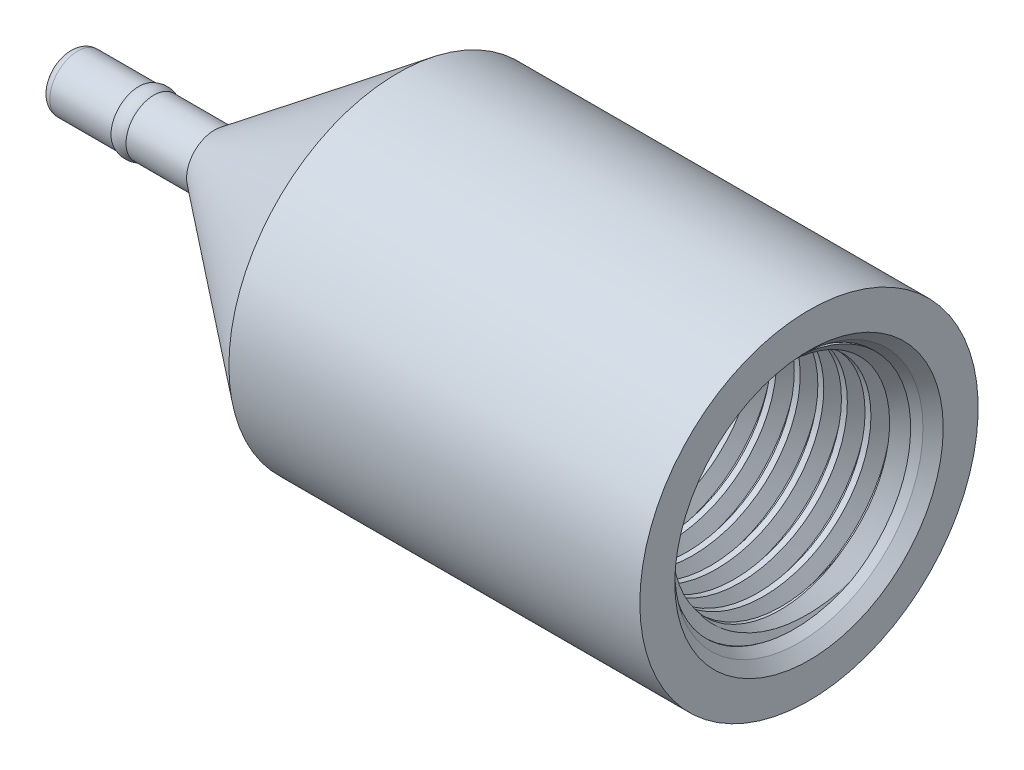
from build123d import *

# Parameters (mm, degrees)
FILLET1_R          = 0.5
THREAD1_PITCH      = 1.27
SKETCH8_R          = 7.225881332
CUT_EXTRUDE1_DEPTH = 2
CUT_EXTRUDE1_DRAFT = -45


with BuildPart() as part:
    # Sketch1 → Revolve1 (revolve)
    with BuildSketch(Plane(origin=(0, 0, 0), x_dir=(1, 0, 0), z_dir=(0, 1, 0))):
        with BuildLine():
            Line((-2.607817174, -13.413523635), (-8.728376935, -13.413523635))
            Line((-8.728376935, -13.413523635), (-11.220003046, -13.413523635))
            Line((-11.220003046, -13.413523635), (-11.220003046, -14.395862586))
            Line((-11.220003046, -14.395862586), (-9.512159646, -14.395862586))
            Line((-9.512159646, -14.395862586), (-7.427574488, -14.395862586))
            ThreePointArc((-7.427574488, -14.395862586), (-7.022483994, -14.495862586), (-6.617393501, -14.395862586))
            Line((-6.617393501, -14.395862586), (-3.358574017, -14.395862586))
            Line((-3.358574017, -14.395862586), (6.526693928, -22.003724809))
            Line((6.526693928, -22.003724809), (28.648530665, -22.003724809))
            Line((28.648530665, -22.003724809), (28.648530665, -19.949280621))
            Line((28.648530665, -19.949280621), (27.619568564, -19.245862586))
            Line((27.619568564, -19.245862586), (7.619568564, -19.245862586))
            Line((7.619568564, -19.245862586), (6.526693928, -18.623851673))
            Line((6.526693928, -18.623851673), (-2.607817174, -13.413523635))
        make_face()
    revolve(axis=Axis((-15.798654761, 0, 12.895862586), (1, 0, 0)))

    # Fillet1
    fillet1_edges = [part.edges().sort_by_distance(p)[0] for p in [
        (-11.220003046, 0, 11.395862586),
    ]]
    fillet(fillet1_edges, radius=FILLET1_R)

    # Thread1: the profile of Thread Profile6 profile screwed along a right-hand helix of 15.748031 turns, 8 arcs to a turn; built about Z, then put on its axis
    thread1_z = Axis((0, 0, 0), (0, 0, 1))
    thread1_corners = [(6.3503, 0, -0.000173205), (6.3503, 0, 1.111423202), (5.662592339, 0, 0.714374999), (5.662592339, 0, 0.396874999)]
    with BuildLine(mode=Mode.PRIVATE) as thread1_profile:
        Line(thread1_corners[0], thread1_corners[1])
        Line(thread1_corners[1], thread1_corners[2])
        Line(thread1_corners[2], thread1_corners[3])
        Line(thread1_corners[3], thread1_corners[0])
    thread1_cap = Face(thread1_profile.wire())
    thread1_turn_angles = [0, 22.5, 45, 67.5, 90, 112.5, 135, 157.5, 180, 202.5, 225, 247.5, 270, 292.5, 315, 337.5, 360]
    thread1_turn_weights = [1, 0.9238795325112867, 1, 0.9238795325112867, 1, 0.9238795325112867, 1, 0.9238795325112867, 1, 0.9238795325112867, 1, 0.9238795325112867, 1, 0.9238795325112867, 1, 0.9238795325112867, 1]
    thread1_turn_rails = [Edge.make_bspline([Vector(p[0], p[1], 0).rotate(thread1_z, thread1_turn_angles[k]) / thread1_turn_weights[k] + Vector(0, 0, p[2] + THREAD1_PITCH * thread1_turn_angles[k] / 360) for k in range(17)], [0, 0, 0, 1, 1, 2, 2, 3, 3, 4, 4, 5, 5, 6, 6, 7, 7, 8, 8, 8], 2, thread1_turn_weights) for p in thread1_corners]
    thread1_turn_sides = [Face.make_surface_from_curves(thread1_turn_rails[p[0]], thread1_turn_rails[p[1]]) for p in [(0, 1), (1, 2), (2, 3), (3, 0)]]
    thread1_last_angles = [5400, 5422.5, 5445, 5467.5, 5490, 5512.5, 5535, 5557.5, 5580, 5602.5, 5625, 5647.145669291, 5669.291338583]
    thread1_last_weights = [1, 0.9238795325112867, 1, 0.9238795325112867, 1, 0.9238795325112867, 1, 0.9238795325112867, 1, 0.9238795325112867, 1, 0.9262284559273419, 1]
    thread1_last_rails = [Edge.make_bspline([Vector(p[0], p[1], 0).rotate(thread1_z, thread1_last_angles[k]) / thread1_last_weights[k] + Vector(0, 0, p[2] + THREAD1_PITCH * thread1_last_angles[k] / 360) for k in range(13)], [0, 0, 0, 1, 1, 2, 2, 3, 3, 4, 4, 5, 5, 6, 6, 6], 2, thread1_last_weights) for p in thread1_corners]
    thread1_last_sides = [Face.make_surface_from_curves(thread1_last_rails[p[0]], thread1_last_rails[p[1]]) for p in [(0, 1), (1, 2), (2, 3), (3, 0)]]
    thread1 = Plane(origin=(28.619568564, 0, 12.895862586), x_dir=(0, 0, 1), z_dir=(-1, 0, 0)) * Solid(Shell([*[p.moved(Location((0, 0, THREAD1_PITCH * i))) for i in range(15) for p in thread1_turn_sides], *thread1_last_sides, thread1_cap, thread1_cap.rotate(thread1_z, 5669.291338583).moved(Location((0, 0, THREAD1_PITCH * 5669.291338583 / 360)))]))
    add(thread1)


with BuildPart() as cut_extrude1_tool:
    # Sketch8 → Cut-Extrude1 (with draft: the straight prism first)
    with BuildSketch(Plane(origin=(28.648530665, 0, 0), x_dir=(0, 0, -1), z_dir=(1, 0, 0))):
        with Locations((-12.895862586, 0)):
            Circle(SKETCH8_R)
    extrude(amount=-CUT_EXTRUDE1_DEPTH)
    # Cut-Extrude1: the draft: its side faces are tilted about the plane it starts from
    cut_extrude1_sides = [cut_extrude1_tool.faces().sort_by_distance(p)[0] for p in [
        (27.648530665, 0, 20.121743918),
    ]]
    draft(cut_extrude1_sides, Plane(origin=(28.648530665, 0, 0), x_dir=(0, 0, -1), z_dir=(1, 0, 0)), CUT_EXTRUDE1_DRAFT)


with BuildPart() as part_1:
    add(part.part)

    # Cut-Extrude1: cut by cut_extrude1_tool
    add(cut_extrude1_tool.part, mode=Mode.SUBTRACT)


solid = part_1.part
